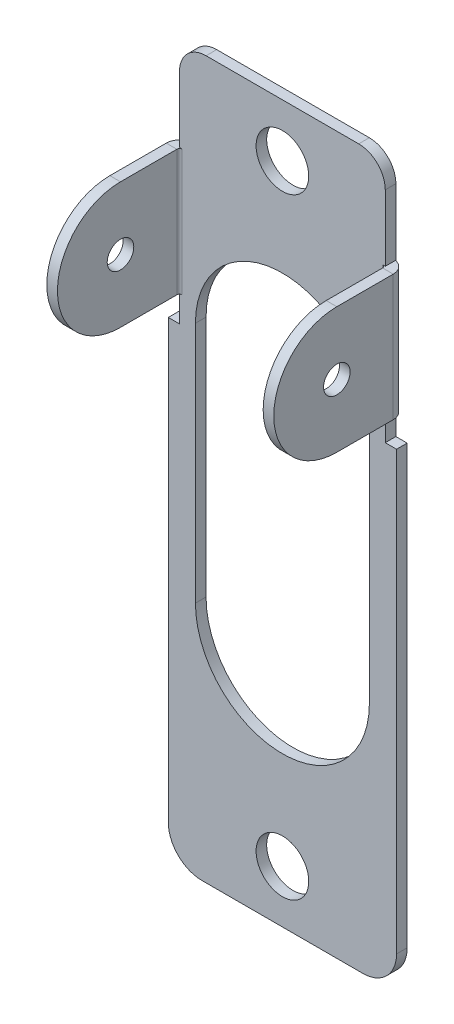
from build123d import *

# Parameters (mm, degrees)
BOSS_EXTRUDE1_START             = -0.8
BOSS_EXTRUDE1_DEPTH             = 1
BOSS_EXTRUDE1_2_OUTLINE_W       = 0.8
BOSS_EXTRUDE1_2_OUTLINE_H       = 9.5
BOSS_EXTRUDE1_2_DEPTH           = 9.2
BOSS_EXTRUDE1_START_2           = 0.85
BOSS_EXTRUDE1_3_OUTLINE_W       = 40.5
BOSS_EXTRUDE1_3_OUTLINE_H       = 0.2
BOSS_EXTRUDE1_3_DEPTH           = 15.5
BOSS_EXTRUDE1_4_OUTLINE_R       = 1
BOSS_EXTRUDE1_4_OUTLINE_W       = 22
BOSS_EXTRUDE1_4_OUTLINE_H       = 0.2
BOSS_EXTRUDE1_4_DEPTH           = 17.2
BOSS_EXTRUDE1_START_3           = 17.112671
BOSS_EXTRUDE1_5_OUTLINE_W       = 9.5
BOSS_EXTRUDE1_5_OUTLINE_H       = 0.2
BOSS_EXTRUDE1_5_DEPTH           = 0.037329
BOSS_EXTRUDE1_START_4           = 0.05
BOSS_EXTRUDE1_6_OUTLINE_W       = 9.5
BOSS_EXTRUDE1_6_OUTLINE_H       = 0.2
BOSS_EXTRUDE1_6_DEPTH           = 0.032671
BOSS_EXTRUDE1_START_5           = 24
BOSS_EXTRUDE1_7_DEPTH           = 9.5
BOSS_EXTRUDE1_8_DEPTH           = 9.5
SKETCH2_W                       = 17.2
SKETCH2_H                       = 35.475
BOSS_EXTRUDE2_DEPTH             = 0.8
FILLET1_R                       = 2.54
F_5_32_0_15625_DIAMETER_HOLE1_D = 3.96875
CUT_EXTRUDE1_DEPTH              = 45.952530518


with BuildPart() as part:
    # Boss-Extrude1: read off the stored shape, not the designer's step
    # Boss-Extrude1 outline → Boss-Extrude1 (new body)
    with BuildSketch(Plane.XY.offset(0.8).offset(BOSS_EXTRUDE1_START)):
        with BuildLine():
            Line((0.05, 24), (1.06, 24))
            Line((1.06, 24), (1.06, 23.99))
            Line((1.06, 23.99), (0.85, 23.99))
            Line((0.85, 23.99), (0.85, 22))
            Line((0.85, 22), (0, 22))
            Line((0, 22), (0, 2))
            ThreePointArc((0, 2), (0.585786438, 0.585786438), (2, 0))
            Line((2, 0), (15.2, 0))
            ThreePointArc((15.2, 0), (16.614213562, 0.585786438), (17.2, 2))
            Line((17.2, 2), (17.2, 22))
            Line((17.2, 22), (16.35, 22))
            Line((16.35, 22), (16.35, 23.99))
            Line((16.35, 23.99), (16.14, 23.99))
            Line((16.14, 23.99), (16.14, 24))
            Line((16.14, 24), (17.15, 24))
            Line((17.15, 24), (17.15, 33.5))
            Line((17.15, 33.5), (16.14, 33.5))
            Line((16.14, 33.5), (16.14, 33.51))
            Line((16.14, 33.51), (16.35, 33.51))
            Line((16.35, 33.51), (16.35, 38.5))
            ThreePointArc((16.35, 38.5), (15.764213562, 39.914213562), (14.35, 40.5))
            Line((14.35, 40.5), (2.85, 40.5))
            ThreePointArc((2.85, 40.5), (1.435786438, 39.914213562), (0.85, 38.5))
            Line((0.85, 38.5), (0.85, 33.51))
            Line((0.85, 33.51), (1.06, 33.51))
            Line((1.06, 33.51), (1.06, 33.5))
            Line((1.06, 33.5), (0.05, 33.5))
            Line((0.05, 33.5), (0.05, 24))
        make_face()
    extrude(amount=BOSS_EXTRUDE1_DEPTH)

    # Boss-Extrude1 2 outline → Boss-Extrude1 2 (add)
    with BuildSketch(Plane.XY.offset(0.8)):
        with Locations((0.45, 28.75)):
            Rectangle(BOSS_EXTRUDE1_2_OUTLINE_W, BOSS_EXTRUDE1_2_OUTLINE_H)
        with Locations((16.75, 28.75)):
            Rectangle(BOSS_EXTRUDE1_2_OUTLINE_W, BOSS_EXTRUDE1_2_OUTLINE_H)
    extrude(amount=BOSS_EXTRUDE1_2_DEPTH)

    # Boss-Extrude1 3 outline → Boss-Extrude1 3 (cut)
    with BuildSketch(Plane.YZ.offset(BOSS_EXTRUDE1_START_2)):
        with Locations((20.25, 0.9)):
            Rectangle(BOSS_EXTRUDE1_3_OUTLINE_W, BOSS_EXTRUDE1_3_OUTLINE_H)
    extrude(amount=BOSS_EXTRUDE1_3_DEPTH, mode=Mode.SUBTRACT)

    # Boss-Extrude1 4 outline → Boss-Extrude1 4 (cut)
    with BuildSketch(Plane.YZ):
        with Locations((28.75, 5.25)):
            Circle(BOSS_EXTRUDE1_4_OUTLINE_R)
        with BuildLine():
            ThreePointArc((28.75, 10), (32.108757211, 8.608757211), (33.5, 5.25))
            Line((33.5, 5.25), (33.5, 10))
            Line((33.5, 10), (28.75, 10))
        make_face()
        with BuildLine():
            ThreePointArc((24, 5.25), (25.391242789, 8.608757211), (28.75, 10))
            Line((28.75, 10), (24, 10))
            Line((24, 10), (24, 5.25))
        make_face()
        with Locations((11, 0.9)):
            Rectangle(BOSS_EXTRUDE1_4_OUTLINE_W, BOSS_EXTRUDE1_4_OUTLINE_H)
    extrude(amount=BOSS_EXTRUDE1_4_DEPTH, mode=Mode.SUBTRACT)

    # Boss-Extrude1 5 outline → Boss-Extrude1 5 (cut)
    with BuildSketch(Plane.YZ.offset(BOSS_EXTRUDE1_START_3)):
        with Locations((28.75, 0.9)):
            Rectangle(BOSS_EXTRUDE1_5_OUTLINE_W, BOSS_EXTRUDE1_5_OUTLINE_H)
    extrude(amount=BOSS_EXTRUDE1_5_DEPTH, mode=Mode.SUBTRACT)

    # Boss-Extrude1 6 outline → Boss-Extrude1 6 (cut)
    with BuildSketch(Plane.YZ.offset(BOSS_EXTRUDE1_START_4)):
        with Locations((28.75, 0.9)):
            Rectangle(BOSS_EXTRUDE1_6_OUTLINE_W, BOSS_EXTRUDE1_6_OUTLINE_H)
    extrude(amount=BOSS_EXTRUDE1_6_DEPTH, mode=Mode.SUBTRACT)

    # Boss-Extrude1 7 outline → Boss-Extrude1 7 (cut)
    with BuildSketch(Plane(origin=(0, 0, 0), x_dir=(1, 0, 0), z_dir=(0, 1, 0)).offset(BOSS_EXTRUDE1_START_5)):
        with BuildLine():
            Line((0.05, -0.8), (0.070204103, -0.8))
            ThreePointArc((0.070204103, -0.8), (0.417544468, -0.225403331), (1.05, 0))
            Line((1.05, 0), (0.05, 0))
            Line((0.05, 0), (0.05, -0.8))
        make_face()
        with BuildLine():
            ThreePointArc((16.15, 0), (16.782455532, -0.225403331), (17.129795897, -0.8))
            Line((17.129795897, -0.8), (17.15, -0.8))
            Line((17.15, -0.8), (17.15, 0))
            Line((17.15, 0), (16.15, 0))
        make_face()
    extrude(amount=BOSS_EXTRUDE1_7_DEPTH, mode=Mode.SUBTRACT)

    # Boss-Extrude1 8 outline → Boss-Extrude1 8 (add)
    with BuildSketch(Plane(origin=(0, 0, 0), x_dir=(1, 0, 0), z_dir=(0, 1, 0)).offset(BOSS_EXTRUDE1_START_5)):
        with BuildLine():
            Line((0.85, -0.8), (0.85, -1))
            ThreePointArc((0.85, -1), (0.908578644, -0.858578644), (1.05, -0.8))
            Line((1.05, -0.8), (0.85, -0.8))
        make_face()
        with BuildLine():
            Line((16.35, -0.8), (16.15, -0.8))
            ThreePointArc((16.15, -0.8), (16.291421356, -0.858578644), (16.35, -1))
            Line((16.35, -1), (16.35, -0.8))
        make_face()
        with BuildLine():
            Line((0.082671, -1), (0.082671, -0.8))
            Line((0.082671, -0.8), (0.070204103, -0.8))
            ThreePointArc((0.070204103, -0.8), (0.055063847, -0.899491038), (0.05, -1))
            Line((0.05, -1), (0.082671, -1))
        make_face()
        with BuildLine():
            Line((17.129795897, -0.8), (17.112671, -0.8))
            Line((17.112671, -0.8), (17.112671, -1))
            Line((17.112671, -1), (17.15, -1))
            ThreePointArc((17.15, -1), (17.144936153, -0.899491038), (17.129795897, -0.8))
        make_face()
    extrude(amount=BOSS_EXTRUDE1_8_DEPTH)

    # Sketch2 → Boss-Extrude2 (add)
    with BuildSketch(Plane.XY.offset(0.8)):
        with Locations((8.6, 4.2625)):
            Rectangle(SKETCH2_W, SKETCH2_H)
    extrude(amount=-BOSS_EXTRUDE2_DEPTH)

    # Fillet1
    fillet1_edges = [part.edges().sort_by_distance(p)[0] for p in [
        (0, -13.475, 0.4),
        (17.2, -13.475, 0.4),
    ]]
    fillet(fillet1_edges, radius=FILLET1_R)

    # 5/32 (0.15625) Diameter Hole1 (through all)
    with Locations(Plane.XY.offset(0.8)):
        with Locations((8.6, -9.5126), (8.6, 36.5122)):
            Hole(F_5_32_0_15625_DIAMETER_HOLE1_D / 2)

    # Sketch5 → Cut-Extrude1 (cut, through all)
    with BuildSketch(Plane.XY.offset(0.8)):
        with BuildLine():
            Line((2.0468, 4.3812), (2.0468, 22.6438))
            ThreePointArc((2.0468, 22.6438), (8.6, 29.197), (15.1532, 22.6438))
            Line((15.1532, 22.6438), (15.1532, 4.3812))
            ThreePointArc((15.1532, 4.3812), (8.6, -2.172), (2.0468, 4.3812))
        make_face()
    extrude(amount=-CUT_EXTRUDE1_DEPTH, mode=Mode.SUBTRACT)


solid = part.part
